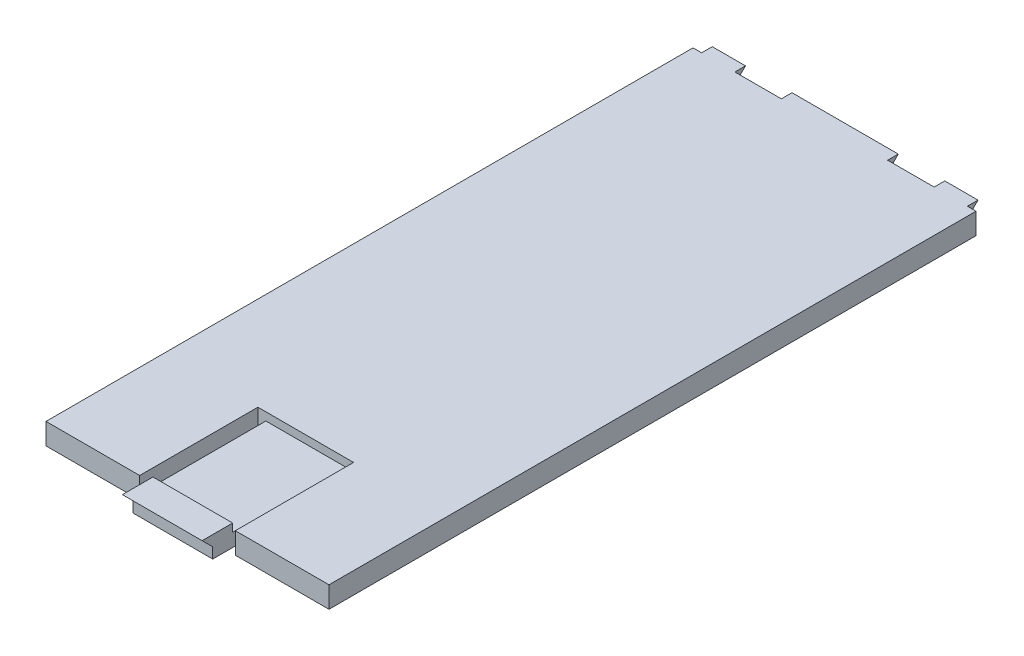
from build123d import *

# Parameters (mm, degrees)
DOOR_PLATE_1_6_DEPTH                  = 1.6
LATCH_FINGER_SLOTS_0_6_SKETCH_W       = 0.6
LATCH_FINGER_SLOTS_0_6_SKETCH_H       = 8.9
LATCH_FINGER_SLOTS_0_6_DEPTH          = 1.6
LATCH_FINGER_THINNING_TO_1_0_SKETCH_W = 6
LATCH_FINGER_THINNING_TO_1_0_SKETCH_H = 8.5
LATCH_FINGER_THINNING_TO_1_0_DEPTH    = 0.6
FAR_TONGUE_STRIP_45DEG_DEPTH          = 40
LATCH_HOOK_STRIP_45DEG_DEPTH          = 40
TONGUE_HOOK_TRIM_SKETCH_W             = 11
TONGUE_HOOK_TRIM_SKETCH_H             = 0.9
TONGUE_HOOK_TRIM_SKETCH_W_2           = 3.5
TONGUE_HOOK_TRIM_SKETCH_W_3           = 18
TONGUE_HOOK_TRIM_DEPTH                = 77.93536248


with BuildPart() as part:
    # Door Plate 1.6 Sketch → Door Plate 1.6 (new body)
    with BuildSketch(Plane(origin=(0, 0, 0), x_dir=(1, 0, 0), z_dir=(0, 1, 0))):
        Polygon((9.35, 16.2), (17, 16.2), (17, 15.1), (23, 15.1), (23, 16.2), (30.65, 16.2), (30.65, 64.9), (9.35, 64.9), align=None)
    extrude(amount=DOOR_PLATE_1_6_DEPTH)

    # Latch Finger Slots 0.6 Sketch → Latch Finger Slots 0.6 (cut)
    with BuildSketch(Plane(origin=(0, 0, 0), x_dir=(1, 0, 0), z_dir=(0, 1, 0))):
        with Locations((16.7, 20.65)):
            Rectangle(LATCH_FINGER_SLOTS_0_6_SKETCH_W, LATCH_FINGER_SLOTS_0_6_SKETCH_H)
        with Locations((23.3, 20.65)):
            Rectangle(LATCH_FINGER_SLOTS_0_6_SKETCH_W, LATCH_FINGER_SLOTS_0_6_SKETCH_H)
    extrude(amount=LATCH_FINGER_SLOTS_0_6_DEPTH, mode=Mode.SUBTRACT)

    # Latch Finger Thinning to 1.0 Sketch → Latch Finger Thinning to 1.0 (cut)
    with BuildSketch(Plane(origin=(0, 1, 0), x_dir=(1, 0, 0), z_dir=(0, 1, 0))):
        with Locations((20, 20.85)):
            Rectangle(LATCH_FINGER_THINNING_TO_1_0_SKETCH_W, LATCH_FINGER_THINNING_TO_1_0_SKETCH_H)
    extrude(amount=LATCH_FINGER_THINNING_TO_1_0_DEPTH, mode=Mode.SUBTRACT)

    # Far Tongue Strip 45deg Sketch → Far Tongue Strip 45deg (add)
    with BuildSketch(Plane(origin=(0, 0, 0), x_dir=(0, 0, -1), z_dir=(1, 0, 0))):
        Polygon((64.9, 0.8), (64.9, 1.6), (65.7, 1.6), align=None)
    extrude(amount=FAR_TONGUE_STRIP_45DEG_DEPTH)

    # Latch Hook Strip 45deg Sketch → Latch Hook Strip 45deg (add)
    with BuildSketch(Plane(origin=(0, 0, 0), x_dir=(0, 0, -1), z_dir=(1, 0, 0))):
        Polygon((15.1, 0.8), (15.1, 1.6), (14.3, 1.6), align=None)
    extrude(amount=LATCH_HOOK_STRIP_45DEG_DEPTH)

    # Tongue + Hook Trim Sketch → Tongue + Hook Trim (cut, through all)
    with BuildSketch(Plane(origin=(0, 0, 0), x_dir=(1, 0, 0), z_dir=(0, 1, 0))):
        with Locations((4.5, 65.35)):
            Rectangle(TONGUE_HOOK_TRIM_SKETCH_W, TONGUE_HOOK_TRIM_SKETCH_H)
        with Locations((14.25, 65.35)):
            Rectangle(TONGUE_HOOK_TRIM_SKETCH_W_2, TONGUE_HOOK_TRIM_SKETCH_H)
        with Locations((25.75, 65.35)):
            Rectangle(TONGUE_HOOK_TRIM_SKETCH_W_2, TONGUE_HOOK_TRIM_SKETCH_H)
        with Locations((35.5, 65.35)):
            Rectangle(TONGUE_HOOK_TRIM_SKETCH_W, TONGUE_HOOK_TRIM_SKETCH_H)
        with Locations((8, 14.65)):
            Rectangle(TONGUE_HOOK_TRIM_SKETCH_W_3, TONGUE_HOOK_TRIM_SKETCH_H)
        with Locations((32, 14.65)):
            Rectangle(TONGUE_HOOK_TRIM_SKETCH_W_3, TONGUE_HOOK_TRIM_SKETCH_H)
    extrude(amount=TONGUE_HOOK_TRIM_DEPTH, mode=Mode.SUBTRACT)


solid = part.part
